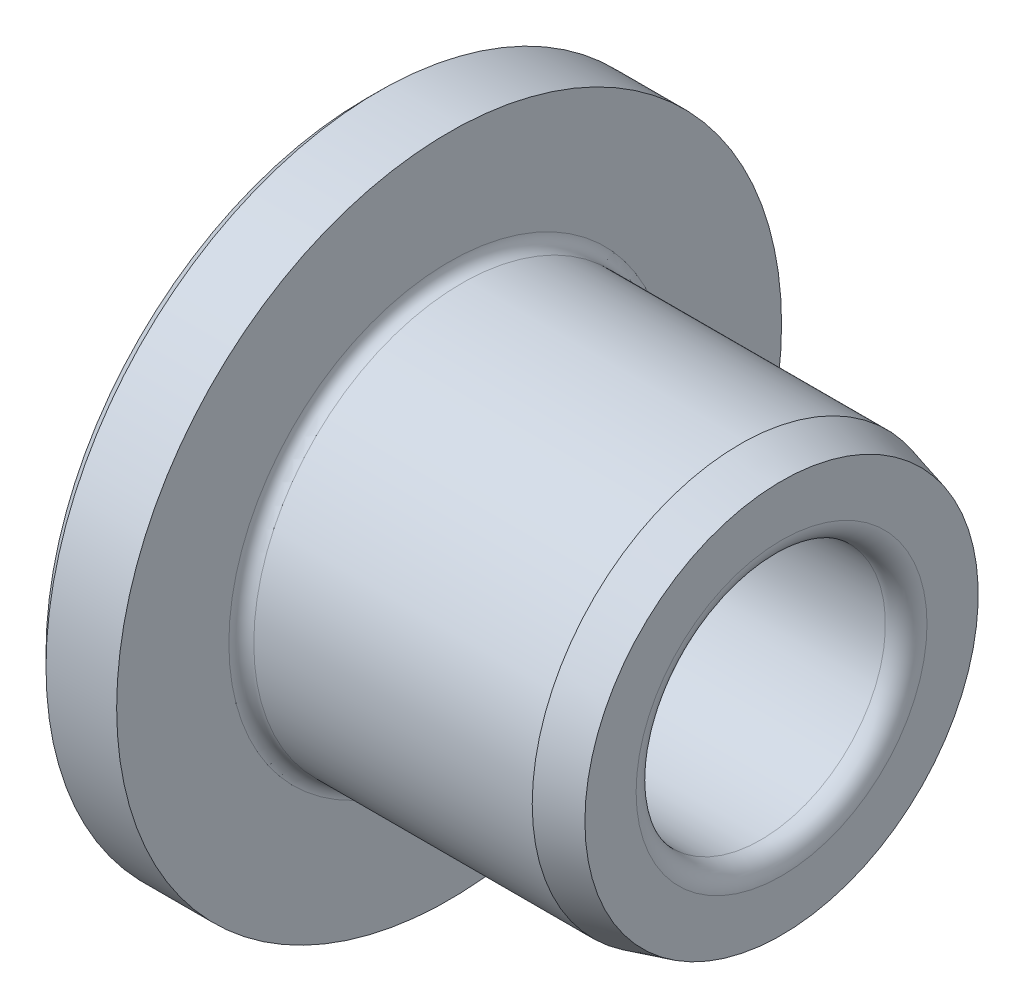
from build123d import *

# Parameters (mm, degrees)
CHAMFER1_SIZE  = 0.3
FILLET1_R      = 0.3
CHAMFER3_SIZE  = 1
CHAMFER3_SIZE2 = 0.267949192
FILLET5_R      = 0.5


with BuildPart() as part:
    # Sketch1 → Revolve1 (revolve)
    with BuildSketch(Plane.XY):
        Polygon((-2, 3), (8, 3), (8, 5), (0, 5), (0, 8), (-2, 8), align=None)
    revolve(axis=Axis((-2, 0, 0), (1, 0, 0)))

    # Chamfer1
    chamfer1_edges = [part.edges().sort_by_distance(p)[0] for p in [
        (-2, -8, 0),
    ]]
    chamfer(chamfer1_edges, length=CHAMFER1_SIZE)

    # Fillet1
    fillet1_edges = [part.edges().sort_by_distance(p)[0] for p in [
        (0, -5, 0),
    ]]
    fillet(fillet1_edges, radius=FILLET1_R)

    # Chamfer3
    chamfer3_edges = [part.edges().sort_by_distance(p)[0] for p in [
        (8, -5, 0),
    ]]
    chamfer3_side = [part.faces().sort_by_distance(p)[0] for p in [
        (4.15, -5, 0),
    ]]
    chamfer(chamfer3_edges, length=CHAMFER3_SIZE, length2=CHAMFER3_SIZE2, reference=chamfer3_side[0])

    # Fillet5
    fillet5_edges = [part.edges().sort_by_distance(p)[0] for p in [
        (8, -3, 0),
        (-2, -3, 0),
    ]]
    fillet(fillet5_edges, radius=FILLET5_R)


solid = part.part
